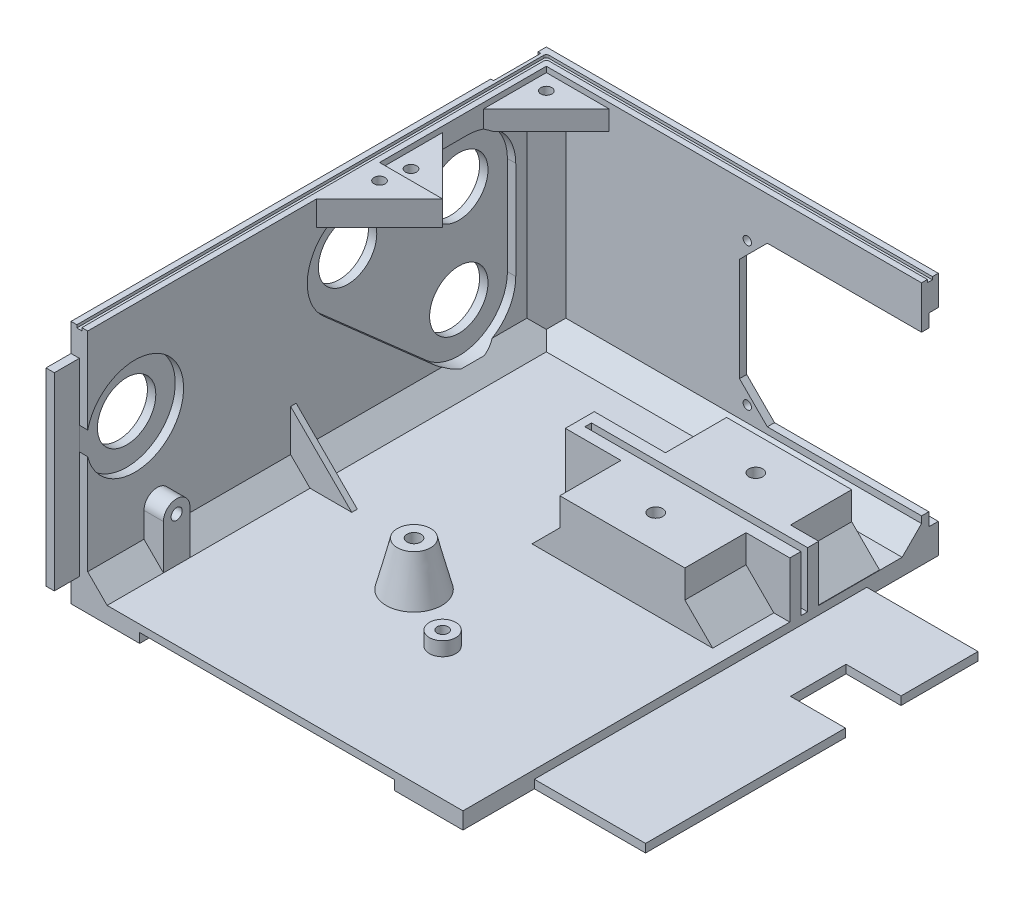
from build123d import *

# Parameters (mm, degrees)
SKETCH1_W                = 141
SKETCH1_H                = 171
BOSS_EXTRUDE1_DEPTH      = 88
SKETCH2_W                = 135
SKETCH2_H                = 165
CUT_EXTRUDE1_DEPTH       = 82
SKETCH3_W                = 40
SKETCH3_H                = 119.6
BOSS_EXTRUDE2_DEPTH      = 3
SKETCH4_W                = 91.6
SKETCH4_H                = 20
CUT_EXTRUDE2_DEPTH       = 3.4
SKETCH5_W                = 9
SKETCH5_H                = 68
BOSS_EXTRUDE3_DEPTH      = 3
SKETCH7_W                = 70.2
SKETCH7_H                = 66.6
CUT_EXTRUDE4_DEPTH       = 3.4
SKETCH9_W                = 65.5
SKETCH9_H                = 57.2
CUT_EXTRUDE5_DEPTH       = 2.6
SKETCH10_R               = 10.5
CUT_EXTRUDE6_DEPTH       = 265.094679992
BOSS_EXTRUDE5_DEPTH      = 7
BOSS_EXTRUDE6_DEPTH      = 9
CUT_EXTRUDE7_DEPTH       = 239.465930481
CUT_EXTRUDE7_DEPTH_BACK  = 2
BOSS_EXTRUDE7_DEPTH      = 73
SKETCH16_R               = 2
CUT_EXTRUDE8_DEPTH       = 5
SKETCH17_R               = 2
CUT_EXTRUDE9_DEPTH       = 5
SKETCH18_R               = 4.75
BOSS_EXTRUDE8_DEPTH      = 5
SKETCH20_R               = 2
CUT_EXTRUDE11_DEPTH      = 5
BOSS_EXTRUDE25_REACH     = 240.466
BOSS_EXTRUDE26_REACH     = 240.466
SKETCH43_R               = 2.5
CUT_EXTRUDE14_DEPTH      = 6
SKETCH45_R               = 4.75
BOSS_EXTRUDE27_DEPTH     = 7
SKETCH46_R               = 2
CUT_EXTRUDE15_DEPTH      = 5
CUT_EXTRUDE16_DEPTH      = 2
CUT_EXTRUDE16_DEPTH_BACK = 3
SKETCH47_R               = 17.5
SKETCH55_W               = 10
SKETCH55_H               = 20
BOSS_EXTRUDE34_DEPTH     = 20
SKETCH56_W               = 20
SKETCH56_H               = 5
BOSS_EXTRUDE35_DEPTH     = 25
CHAMFER2_SIZE            = 10
CHAMFER3_SIZE            = 10
SKETCH57_R               = 2.5
CUT_EXTRUDE17_DEPTH      = 5
BOSS_EXTRUDE36_DEPTH     = 20
CHAMFER6_SIZE            = 5
BOSS_EXTRUDE37_DEPTH     = 20
CHAMFER7_SIZE            = 10
CHAMFER8_SIZE            = 10
SKETCH60_R               = 2.5
CUT_EXTRUDE18_DEPTH      = 5
CUT_EXTRUDE19_DEPTH      = 1
SKETCH63_W               = 17
SKETCH63_H               = 88
CUT_EXTRUDE20_DEPTH      = 1
BOSS_EXTRUDE39_START     = -7
BOSS_EXTRUDE39_DEPTH     = 7
BOSS_EXTRUDE40_DEPTH     = 2
SKETCH67_W               = 77.75
SKETCH67_H               = 20
BOSS_EXTRUDE41_DEPTH     = 1
BOSS_EXTRUDE42_DEPTH     = 2.6
SKETCH69_R               = 1.5
CUT_EXTRUDE21_DEPTH      = 2.6
FILLET1_R                = 1
FILLET2_R                = 1
SKETCH70_W               = 25
SKETCH70_H               = 20
CUT_EXTRUDE22_DEPTH      = 6
BOSS_EXTRUDE43_DEPTH     = 2
BOSS_EXTRUDE44_DEPTH     = 2
SKETCH73_W               = 19.76
SKETCH73_H               = 20
CUT_EXTRUDE23_DEPTH      = 3
SKETCH74_R               = 2
CUT_EXTRUDE24_DEPTH      = 5


with BuildPart() as part:
    # Sketch1 → Boss-Extrude1 (new body)
    with BuildSketch(Plane(origin=(0, 0, 0), x_dir=(1, 0, 0), z_dir=(0, 1, 0))):
        with Locations((-70.5, 85.5)):
            Rectangle(SKETCH1_W, SKETCH1_H)
    extrude(amount=BOSS_EXTRUDE1_DEPTH)

    # Sketch2 → Cut-Extrude1 (cut)
    with BuildSketch(Plane(origin=(0, 88, 0), x_dir=(1, 0, 0), z_dir=(0, 1, 0))):
        with Locations((-67.5, 82.5)):
            Rectangle(SKETCH2_W, SKETCH2_H)
    extrude(amount=-CUT_EXTRUDE1_DEPTH, mode=Mode.SUBTRACT)

    # Sketch3 → Boss-Extrude2 (add)
    with BuildSketch(Plane.XZ):
        with Locations((20, -85.5)):
            Rectangle(SKETCH3_W, SKETCH3_H)
    extrude(amount=-BOSS_EXTRUDE2_DEPTH)

    # Sketch4 → Cut-Extrude2 (cut)
    with BuildSketch(Plane.XZ):
        with Locations((-70.5, -10)):
            Rectangle(SKETCH4_W, SKETCH4_H)
    extrude(amount=-CUT_EXTRUDE2_DEPTH, mode=Mode.SUBTRACT)

    # Sketch7 → Cut-Extrude4 (cut)
    with BuildSketch(Plane(origin=(0, 0, -171), x_dir=(-1, 0, 0), z_dir=(0, 0, -1))):
        with Locations((35.1, 44)):
            Rectangle(SKETCH7_W, SKETCH7_H)
    extrude(amount=-CUT_EXTRUDE4_DEPTH, mode=Mode.SUBTRACT)

    # Sketch9 → Cut-Extrude5 (cut)
    with BuildSketch(Plane(origin=(0, 0, -167.6), x_dir=(-1, 0, 0), z_dir=(0, 0, -1))):
        with Locations((32.75, 44)):
            Rectangle(SKETCH9_W, SKETCH9_H)
    extrude(amount=-CUT_EXTRUDE5_DEPTH, mode=Mode.SUBTRACT)

    # Sketch10 → Cut-Extrude6 (cut, through all)
    with BuildSketch(Plane.ZY.offset(141)):
        with Locations((-136.5, 28)):
            Circle(SKETCH10_R)
        with Locations((-96.5, 63.25)):
            Circle(SKETCH10_R)
        with Locations((-136.5, 63.25)):
            Circle(SKETCH10_R)
        with Locations((-17, 53)):
            Circle(SKETCH10_R)
    extrude(amount=-CUT_EXTRUDE6_DEPTH, mode=Mode.SUBTRACT)

    # Sketch12 → Boss-Extrude5 (add)
    with BuildSketch(Plane(origin=(0, 86, 0), x_dir=(1, 0, 0), z_dir=(0, 1, 0))):
        Polygon((-112.372583002, 165), (-135, 165), (-135, 142.372583002), align=None)
    extrude(amount=-BOSS_EXTRUDE5_DEPTH)

    # Sketch13 → Boss-Extrude6 (add)
    with BuildSketch(Plane(origin=(0, 88, 0), x_dir=(1, 0, 0), z_dir=(0, 1, 0))):
        Polygon((-135, 82.372583002), (-112.372583002, 105), (-135, 127.627416998), align=None)
    extrude(amount=-BOSS_EXTRUDE6_DEPTH)

    # Sketch14 → Cut-Extrude7 (cut, two sides: drawn at the far end of the back side and taken through both)
    with BuildSketch(Plane(origin=(0, 88, 0), x_dir=(1, 0, 0), z_dir=(0, 1, 0)).offset(-CUT_EXTRUDE7_DEPTH_BACK)):
        Polygon((-112.372583002, 105), (-135, 127.627416998), (-135, 105), align=None)
    extrude(amount=CUT_EXTRUDE7_DEPTH + CUT_EXTRUDE7_DEPTH_BACK, mode=Mode.SUBTRACT)

    # Sketch15 → Boss-Extrude7 (add)
    with BuildSketch(Plane(origin=(0, 6, 0), x_dir=(1, 0, 0), z_dir=(0, 1, 0))):
        Polygon((-135, 165), (-135, 158), (-128, 165), align=None)
    extrude(amount=BOSS_EXTRUDE7_DEPTH)

    # Sketch16 → Cut-Extrude8 (cut)
    with BuildSketch(Plane(origin=(0, 86, 0), x_dir=(1, 0, 0), z_dir=(0, 1, 0))):
        with Locations(Location((-129.343145751, 159.343145751, 0), (0, 0, 270))):
            Circle(SKETCH16_R)
        with Locations(Location((-129.343145751, 110.656854249, 0), (0, 0, 270))):
            Circle(SKETCH16_R)
    extrude(amount=-CUT_EXTRUDE8_DEPTH, mode=Mode.SUBTRACT)

    # Sketch17 → Cut-Extrude9 (cut)
    with BuildSketch(Plane(origin=(0, 88, 0), x_dir=(1, 0, 0), z_dir=(0, 1, 0))):
        with Locations(Location((-129.343145751, 99.343145751, 0), (0, 0, 270))):
            Circle(SKETCH17_R)
    extrude(amount=-CUT_EXTRUDE9_DEPTH, mode=Mode.SUBTRACT)

    # Sketch18 → Boss-Extrude8 (add)
    with BuildSketch(Plane(origin=(0, 6, 0), x_dir=(1, 0, 0), z_dir=(0, 1, 0))):
        with Locations(Location((-55, 47.7, 0), (0, 0, 270))):
            Circle(SKETCH18_R)
    extrude(amount=BOSS_EXTRUDE8_DEPTH)

    # Sketch20 → Cut-Extrude11 (cut)
    with BuildSketch(Plane(origin=(0, 11, 0), x_dir=(1, 0, 0), z_dir=(0, 1, 0))):
        with Locations(Location((-55, 47.7, 0), (0, 0, 270))):
            Circle(SKETCH20_R)
    extrude(amount=-CUT_EXTRUDE11_DEPTH, mode=Mode.SUBTRACT)

    # Boss-Extrude25: up to this plane
    boss_extrude25_end = Plane(origin=(-135, 88.899494937, -158), z_dir=(-0.7071067811865476, 0, -0.7071067811865476))
    # Sketch39 → Boss-Extrude25 (add, up to the surface)
    with BuildSketch(Plane.XY, mode=Mode.PRIVATE) as boss_extrude25_sk1:
        Polygon((-135, 6), (-135, 13), (-128, 6), align=None)
    boss_extrude25_tool1 = split(extrude(boss_extrude25_sk1.sketch, amount=-BOSS_EXTRUDE25_REACH, mode=Mode.PRIVATE), bisect_by=boss_extrude25_end, keep=Keep.BOTH, mode=Mode.PRIVATE)
    add(boss_extrude25_tool1.solids().sort_by_distance((-132.666667, 8.333333, 0))[0])

    # Boss-Extrude26: up to this plane
    boss_extrude26_end = Plane(origin=(-135, 13, -173.449747468), z_dir=(0.7071067811865476, 0.7071067811865476, 0))
    # Sketch40 → Boss-Extrude26 (add, up to the surface)
    with BuildSketch(Plane(origin=(0, 0, 0), x_dir=(0, 0, -1), z_dir=(1, 0, 0)), mode=Mode.PRIVATE) as boss_extrude26_sk1:
        Polygon((165, 6), (158, 6), (165, 13), align=None)
    boss_extrude26_tool1 = split(extrude(boss_extrude26_sk1.sketch, amount=-BOSS_EXTRUDE26_REACH, mode=Mode.PRIVATE), bisect_by=boss_extrude26_end, keep=Keep.BOTH, mode=Mode.PRIVATE)
    add(boss_extrude26_tool1.solids().sort_by_distance((0, 8.333333, -162.666667))[0])

    # Loft1: read off the stored shape, not the designer's step
    # Loft1: loft between two sections, ruled curve by curve
    loft1_from = [
        Edge.make_bspline([(-73.665466322, 22, -55.793608417), (-82.418249488, 22, -47.584541061), (-90.627316844, 22, -56.337324227), (-81.874533678, 22, -64.546391583), (-73.121750512, 22, -72.755458939), (-64.912683156, 22, -64.002675773), (-73.665466322, 22, -55.793608417)], [0, 0, 0, 0, 0.5, 0.5, 0.5, 1, 1, 1, 1], 3, [1, 0.333333333, 0.333333333, 1, 0.333333333, 0.333333333, 1]),
    ]
    loft1_to = [
        Edge.make_bspline([(-72.815413316, 6, -51.483684856), (-90.188043604, 6, -41.574511487), (-100.097216973, 6, -58.947141776), (-82.724586684, 6, -68.856315144), (-65.351956396, 6, -78.765488513), (-55.442783027, 6, -61.392858224), (-72.815413316, 6, -51.483684856)], [0, 0, 0, 0, 0.5, 0.5, 0.5, 1, 1, 1, 1], 3, [1, 0.333333333, 0.333333333, 1, 0.333333333, 0.333333333, 1]),
    ]
    loft1 = Solid(Shell([*[Face.make_surface_from_curves(loft1_from[k], loft1_to[k]) for k in range(1)], Face(Wire(loft1_from)), Face(Wire(loft1_to))]))
    add(loft1)

    # Sketch43 → Cut-Extrude14 (cut)
    with BuildSketch(Plane(origin=(0, 22, 0), x_dir=(1, 0, 0), z_dir=(0, 1, 0))):
        with Locations(Location((-77.77, 60.17, 0), (0, 0, 270))):
            Circle(SKETCH43_R)
    extrude(amount=-CUT_EXTRUDE14_DEPTH, mode=Mode.SUBTRACT)

    # Sketch45 → Boss-Extrude27 (add)
    with BuildSketch(Plane(origin=(-135, 0, 0), x_dir=(0, 0, -1), z_dir=(1, 0, 0))):
        with Locations(Location((25, 22, 0), (0, 0, 180))):
            Circle(SKETCH45_R)
    extrude(amount=BOSS_EXTRUDE27_DEPTH)

    # Sketch46 → Cut-Extrude15 (cut)
    with BuildSketch(Plane(origin=(-128, 0, 0), x_dir=(0, 0, -1), z_dir=(1, 0, 0))):
        with Locations((25, 22)):
            Circle(SKETCH46_R)
    extrude(amount=-CUT_EXTRUDE15_DEPTH, mode=Mode.SUBTRACT)

    # Sketch47 → Cut-Extrude16 (cut, two sides: drawn at the far end of the back side and taken through both)
    with BuildSketch(Plane(origin=(-135, 0, 0), x_dir=(0, 0, -1), z_dir=(1, 0, 0)).offset(-CUT_EXTRUDE16_DEPTH_BACK)):
        with Locations((17, 53)):
            Circle(SKETCH47_R)
        with BuildLine():
            Line((96.5, 80.75), (136.5, 80.75))
            ThreePointArc((136.5, 80.75), (148.874368671, 75.624368671), (154, 63.25))
            Line((154, 63.25), (154, 28))
            ThreePointArc((154, 28), (143.703155465, 12.051189658), (124.929765561, 14.870655956))
            Line((124.929765561, 14.870655956), (84.929765561, 50.120655956))
            ThreePointArc((84.929765561, 50.120655956), (80.129087979, 69.434111869), (96.5, 80.75))
        make_face()
    extrude(amount=CUT_EXTRUDE16_DEPTH + CUT_EXTRUDE16_DEPTH_BACK, mode=Mode.SUBTRACT)

    # Sketch55 → Boss-Extrude34 (add)
    with BuildSketch(Plane(origin=(0, 6, 0), x_dir=(1, 0, 0), z_dir=(0, 1, 0))):
        with Locations((-50.14, 138)):
            Rectangle(SKETCH55_W, SKETCH55_H)
        with Locations((-15.14, 138)):
            Rectangle(SKETCH55_W, SKETCH55_H)
    extrude(amount=BOSS_EXTRUDE34_DEPTH)

    # Sketch56 → Boss-Extrude35 (add)
    with BuildSketch(Plane(origin=(-45.14, 0, 0), x_dir=(0, 0, -1), z_dir=(1, 0, 0))):
        with Locations((138, 23.5)):
            Rectangle(SKETCH56_W, SKETCH56_H)
    extrude(amount=BOSS_EXTRUDE35_DEPTH)

    # Chamfer2
    chamfer2_edges = [part.edges().sort_by_distance(p)[0] for p in [
        (-10.14, 6, -138),
    ]]
    chamfer(chamfer2_edges, length=CHAMFER2_SIZE)

    # Chamfer3
    chamfer3_edges = [part.edges().sort_by_distance(p)[0] for p in [
        (-55.14, 6, -138),
    ]]
    chamfer(chamfer3_edges, length=CHAMFER3_SIZE)

    # Sketch57 → Cut-Extrude17 (cut)
    with BuildSketch(Plane(origin=(0, 26, 0), x_dir=(1, 0, 0), z_dir=(0, 1, 0))):
        with Locations(Location((-32.64, 138, 0), (0, 0, 270))):
            Circle(SKETCH57_R)
    extrude(amount=-CUT_EXTRUDE17_DEPTH, mode=Mode.SUBTRACT)

    # Sketch58 → Boss-Extrude36 (add)
    with BuildSketch(Plane(origin=(0, 6, 0), x_dir=(1, 0, 0), z_dir=(0, 1, 0))):
        Polygon((0, 125), (0, 128), (-0.14, 128), (-20.14, 128), (-45.14, 128), (-65.14, 128), (-80.75, 128), (-80.75, 117.6), (0, 117.6), (0, 121.6), (-77.75, 121.6), (-77.75, 125), align=None)
    extrude(amount=BOSS_EXTRUDE36_DEPTH)

    # Chamfer6
    chamfer6_edges = [part.edges().sort_by_distance(p)[0] for p in [
        (-72.945, 6, -128),
    ]]
    chamfer(chamfer6_edges, length=CHAMFER6_SIZE)

    # Sketch59 → Boss-Extrude37 (add)
    with BuildSketch(Plane.XY.offset(-117.6)):
        Polygon((-60.75, 6), (-60.75, 26), (-15.75, 26), (-15.75, 6), (-25.75, 6), (-25.75, 21), (-50.75, 21), (-50.75, 6), align=None)
    extrude(amount=BOSS_EXTRUDE37_DEPTH)

    # Chamfer7
    chamfer7_edges = [part.edges().sort_by_distance(p)[0] for p in [
        (-60.75, 6, -107.6),
    ]]
    chamfer(chamfer7_edges, length=CHAMFER7_SIZE)

    # Chamfer8
    chamfer8_edges = [part.edges().sort_by_distance(p)[0] for p in [
        (-15.75, 6, -107.6),
    ]]
    chamfer(chamfer8_edges, length=CHAMFER8_SIZE)

    # Sketch60 → Cut-Extrude18 (cut)
    with BuildSketch(Plane(origin=(0, 26, 0), x_dir=(1, 0, 0), z_dir=(0, 1, 0))):
        with Locations(Location((-38.25, 107.6, 0), (0, 0, 270))):
            Circle(SKETCH60_R)
    extrude(amount=-CUT_EXTRUDE18_DEPTH, mode=Mode.SUBTRACT)

    # Sketch61 → Cut-Extrude19 (cut)
    with BuildSketch(Plane(origin=(0, 88, 0), x_dir=(1, 0, 0), z_dir=(0, 1, 0))):
        Polygon((-138.9, 0), (-137.1, 0), (-137.1, 167.1), (0, 167.1), (0, 168.9), (-138.9, 168.9), align=None)
    extrude(amount=-CUT_EXTRUDE19_DEPTH, mode=Mode.SUBTRACT)

    # Sketch63 → Cut-Extrude20 (cut)
    with BuildSketch(Plane.ZY.offset(141)):
        with Locations((-159.5, 44)):
            Rectangle(SKETCH63_W, SKETCH63_H)
    extrude(amount=-CUT_EXTRUDE20_DEPTH, mode=Mode.SUBTRACT)

    # Sketch64 → Boss-Extrude39 (add)
    with BuildSketch(Plane(origin=(-128, 0, 0), x_dir=(0, 0, -1), z_dir=(1, 0, 0)).offset(BOSS_EXTRUDE39_START)):
        with BuildLine():
            Line((20.25, 22), (20.25, 6))
            Line((20.25, 6), (29.75, 6))
            Line((29.75, 6), (29.75, 22))
            ThreePointArc((29.75, 22), (25, 17.25), (20.25, 22))
        make_face()
    extrude(amount=BOSS_EXTRUDE39_DEPTH)

    # Sketch66 → Boss-Extrude40 (add)
    with BuildSketch(Plane.XY.offset(-75)):
        Polygon((-135, 13), (-135, 28), (-113, 6), (-128, 6), align=None)
    extrude(amount=BOSS_EXTRUDE40_DEPTH)

    # Sketch67 → Boss-Extrude41 (add)
    with BuildSketch(Plane.XY.offset(-125)):
        with Locations((-38.875, 16)):
            Rectangle(SKETCH67_W, SKETCH67_H)
    extrude(amount=BOSS_EXTRUDE41_DEPTH)

    # Sketch68 → Boss-Extrude42 (add)
    with BuildSketch(Plane(origin=(0, 0, -167.6), x_dir=(-1, 0, 0), z_dir=(0, 0, -1))):
        Polygon((65.5, 72.6), (55.5, 72.6), (65.5, 62.6), align=None)
        Polygon((65.5, 15.4), (65.5, 25.4), (55.5, 15.4), align=None)
    extrude(amount=-BOSS_EXTRUDE42_DEPTH)

    # Sketch69 → Cut-Extrude21 (cut)
    with BuildSketch(Plane(origin=(0, 0, -167.6), x_dir=(-1, 0, 0), z_dir=(0, 0, -1))):
        with Locations((62.7, 69.8)):
            Circle(SKETCH69_R)
        with Locations((62.7, 18.6)):
            Circle(SKETCH69_R)
    extrude(amount=-CUT_EXTRUDE21_DEPTH, mode=Mode.SUBTRACT)

    # Fillet1
    fillet1_edges = [part.edges().sort_by_distance(p)[0] for p in [
        (-137.1, 87.5, -167.1),
    ]]
    fillet(fillet1_edges, radius=FILLET1_R)

    # Fillet2
    fillet2_edges = [part.edges().sort_by_distance(p)[0] for p in [
        (-138.9, 87.5, -168.9),
    ]]
    fillet(fillet2_edges, radius=FILLET2_R)

    # Sketch70 → Cut-Extrude22 (cut)
    with BuildSketch(Plane.XZ):
        with Locations((-32.64, -138)):
            Rectangle(SKETCH70_W, SKETCH70_H)
        with Locations((-38.25, -107.6)):
            Rectangle(SKETCH70_W, SKETCH70_H)
    extrude(amount=-CUT_EXTRUDE22_DEPTH, mode=Mode.SUBTRACT)

    # Sketch71 → Boss-Extrude43 (add)
    with BuildSketch(Plane(origin=(0, 0, -148), x_dir=(-1, 0, 0), z_dir=(0, 0, -1))):
        Polygon((10.14, 16), (0.14, 6), (20.14, 6), (45.14, 6), (65.14, 6), (55.14, 16), (55.14, 26), (10.14, 26), align=None)
    extrude(amount=BOSS_EXTRUDE43_DEPTH)

    # Sketch72 → Boss-Extrude44 (add)
    with BuildSketch(Plane.XY.offset(-97.6)):
        Polygon((-5.75, 6), (-15.75, 16), (-15.75, 26), (-60.75, 26), (-60.75, 16), (-70.75, 6), (-50.75, 6), (-25.75, 6), align=None)
    extrude(amount=BOSS_EXTRUDE44_DEPTH)

    # Sketch73 → Cut-Extrude23 (cut)
    with BuildSketch(Plane.XZ):
        with Locations((30.12, -107.6)):
            Rectangle(SKETCH73_W, SKETCH73_H)
    extrude(amount=-CUT_EXTRUDE23_DEPTH, mode=Mode.SUBTRACT)

    # Sketch74 → Cut-Extrude24 (cut)
    with BuildSketch(Plane.XZ):
        with Locations(Location((-120, -159.5, 0), (0, 0, 270))):
            Circle(SKETCH74_R)
    extrude(amount=-CUT_EXTRUDE24_DEPTH, mode=Mode.SUBTRACT)


with BuildPart() as body_2:
    # Sketch5 → Boss-Extrude3 (new body)
    with BuildSketch(Plane.ZY.offset(141)):
        with Locations((4.5, 44)):
            Rectangle(SKETCH5_W, SKETCH5_H)
    extrude(amount=-BOSS_EXTRUDE3_DEPTH)


solid = Compound([part.part, body_2.part])
